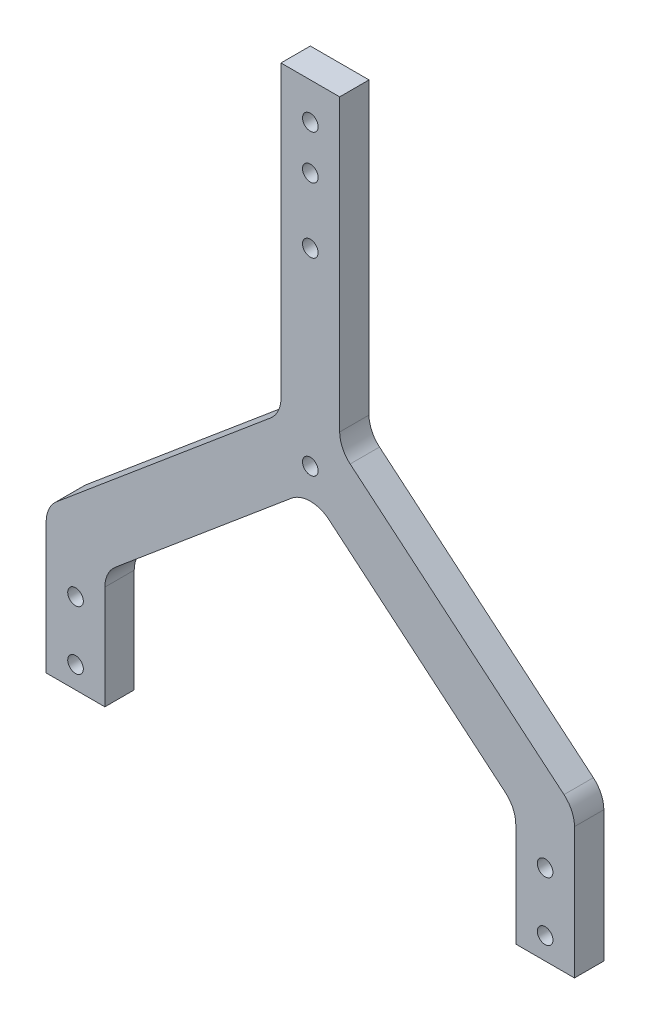
from build123d import *

# Parameters (mm, degrees)
BOSS_EXTRUDE1_DEPTH     = 6.35
FILLET1_R               = 12.7
F_1_4_CLEARANCE_HOLE1_D = 6.7564
F_1_4_CLEARANCE_HOLE2_D = 6.7564
F_1_4_CLEARANCE_HOLE3_D = 6.7564
F_1_4_CLEARANCE_HOLE4_D = 6.7564


with BuildPart() as part:
    # Sketch1 → Boss-Extrude1 (new, symmetric)
    with BuildSketch(Plane.XY):
        Polygon((-88.9, 0), (-114.3, 0), (-114.3, 62.644214517), (-41.726805286, 123.540355435), (-12.7, 147.896737045), (-12.7, 279.4), (12.7, 279.4), (12.7, 147.896737045), (41.726805286, 123.540355435), (114.3, 62.644214517), (114.3, 0), (88.9, 0), (88.9, 50.8), (25.4, 104.08282658), (0, 125.395957212), (-25.4, 104.08282658), (-88.9, 50.8), align=None)
    extrude(amount=BOSS_EXTRUDE1_DEPTH, both=True)

    # Fillet1
    fillet1_edges = [part.edges().sort_by_distance(p)[0] for p in [
        (-12.7, 147.896737045, 0),
        (12.7, 147.896737045, 0),
        (-114.3, 62.644214517, 0),
        (114.3, 62.644214517, 0),
        (88.9, 50.8, 0),
        (0, 125.395957212, 0),
        (-88.9, 50.8, 0),
    ]]
    fillet(fillet1_edges, radius=FILLET1_R)

    # 1/4 Clearance Hole1 (through all)
    with Locations(Plane.XY.offset(6.35)):
        with Locations((101.6, 34.925), (-101.6, 9.525), (-101.6, 34.925), (101.6, 9.525)):
            Hole(F_1_4_CLEARANCE_HOLE1_D / 2)

    # 1/4 Clearance Hole2 (through all)
    with Locations(Plane.XY.offset(6.35)):
        with Locations((0, 263.525), (0, 244.475)):
            Hole(F_1_4_CLEARANCE_HOLE2_D / 2)

    # 1/4 Clearance Hole3 (through all)
    with Locations(Plane(origin=(0, 0, -6.35), x_dir=(-1, 0, 0), z_dir=(0, 0, -1))):
        with Locations((0, 134.62)):
            Hole(F_1_4_CLEARANCE_HOLE3_D / 2)

    # 1/4 Clearance Hole4 (through all)
    with Locations(Plane.XY.offset(6.35)):
        with Locations((0, 216.319377674)):
            Hole(F_1_4_CLEARANCE_HOLE4_D / 2)


solid = part.part
